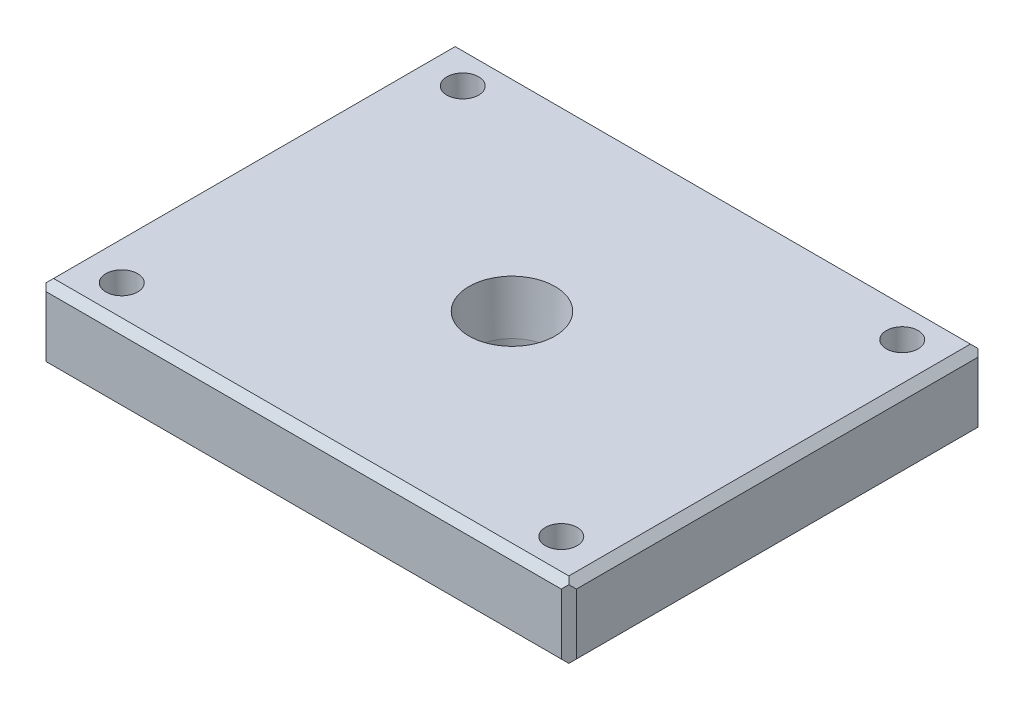
from build123d import *

# Parameters (mm, degrees)
SKETCH1_W           = 70
SKETCH1_H           = 55
BOSS_EXTRUDE1_DEPTH = 10
CHAMFER1_SIZE       = 1
SKETCH2_R           = 5.2
CUT_EXTRUDE1_DEPTH  = 46.620718977
CHAMFER2_SIZE       = 1
M5_TAPPED_HOLE1_D   = 4.2


# Read off the part's stored shape, not the designer's step: Draft1
with BuildPart() as part:
    # Sketch1 → Boss-Extrude1 (new body)
    with BuildSketch(Plane(origin=(0, 0, 0), x_dir=(1, 0, 0), z_dir=(0, 1, 0))):
        Rectangle(SKETCH1_W, SKETCH1_H)
    extrude(amount=-BOSS_EXTRUDE1_DEPTH)

    # Chamfer1
    chamfer1_edges = [part.edges().sort_by_distance(p)[0] for p in [
        (-35, -10, 0),
        (0, -10, 27.5),
        (35, -10, 0),
        (0, 0, 27.5),
        (-35, 0, 0),
        (0, 0, -27.5),
        (35, 0, 0),
        (0, -10, -27.5),
    ]]
    chamfer(chamfer1_edges, length=CHAMFER1_SIZE)

    # Sketch2 → Cut-Extrude1 (cut, through all)
    with BuildSketch(Plane(origin=(0, 0, 0), x_dir=(1, 0, 0), z_dir=(0, 1, 0))):
        with Locations(Location((0, 0, 0), (0, 0, 270))):
            Circle(SKETCH2_R)
    extrude(amount=-CUT_EXTRUDE1_DEPTH, mode=Mode.SUBTRACT)

    # Chamfer2
    chamfer2_edges = [part.edges().sort_by_distance(p)[0] for p in [
        (35, -5, -27.5),
        (-35, -5, -27.5),
        (-35, -5, 27.5),
        (35, -5, 27.5),
    ]]
    chamfer(chamfer2_edges, length=CHAMFER2_SIZE)

    # M5 Tapped Hole1 (through all)
    with Locations(Plane(origin=(0, 0, 0), x_dir=(1, 0, 0), z_dir=(0, 1, 0))):
        with Locations((-29, 22.5), (29, 22.5), (29, -22.5), (-29, -22.5)):
            Hole(M5_TAPPED_HOLE1_D / 2)

    # Draft1 outline → Draft1 (revolve, cut)
    with BuildSketch(Plane.XY):
        Polygon((5.2, 0), (5.2, -6.8), (5.675502321, 0), align=None)
    revolve(axis=Axis((0, 0, 0), (0, 1, 0)), mode=Mode.SUBTRACT)


solid = part.part
